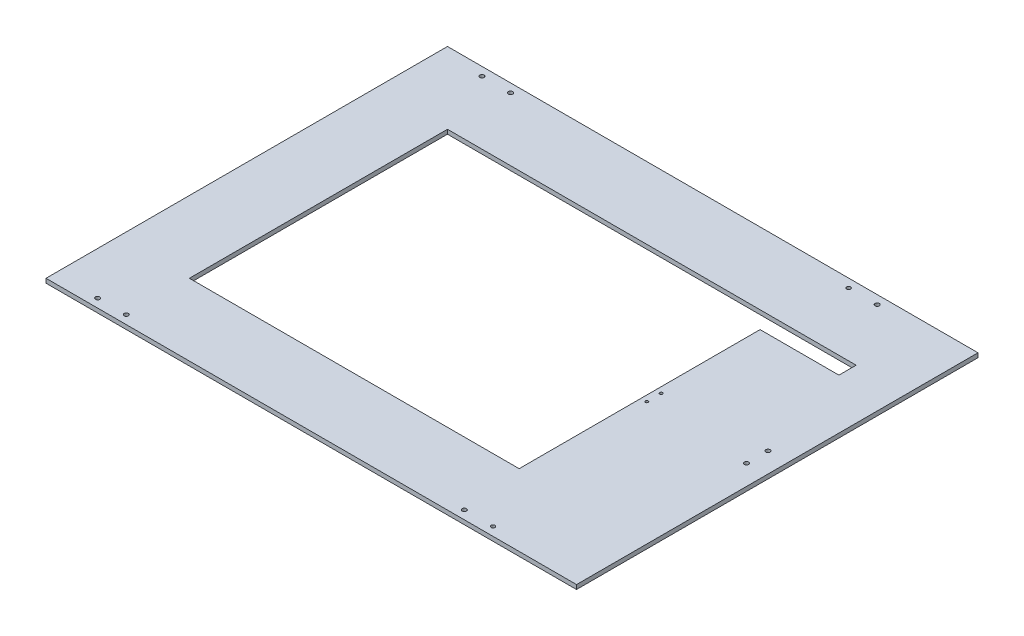
from build123d import *

# Parameters (mm, degrees)
SKETCH1_W           = 370
SKETCH1_H           = 280
SKETCH1_R           = 1.5
SKETCH1_R_2         = 1.569181713
SKETCH1_R_3         = 1.357318829
SKETCH1_R_4         = 1.322467774
SKETCH1_R_5         = 1
SKETCH1_W_2         = 230
SKETCH1_H_2         = 180
BOSS_EXTRUDE1_DEPTH = 3
SKETCH2_W           = 55
SKETCH2_H           = 12
CUT_EXTRUDE1_DEPTH  = 10
SKETCH3_R           = 1.5
CUT_EXTRUDE2_DEPTH  = 10


with BuildPart() as part:
    # Sketch1 → Boss-Extrude1 (new body)
    with BuildSketch(Plane(origin=(0, 0, 0), x_dir=(1, 0, 0), z_dir=(0, 1, 0))):
        with Locations((185, 140)):
            Rectangle(SKETCH1_W, SKETCH1_H)
        with Locations((30, 274)):
            Circle(SKETCH1_R, mode=Mode.SUBTRACT)
        with Locations((50, 274)):
            Circle(SKETCH1_R_2, mode=Mode.SUBTRACT)
        with Locations((30, 6)):
            Circle(SKETCH1_R, mode=Mode.SUBTRACT)
        with Locations((50, 6)):
            Circle(SKETCH1_R, mode=Mode.SUBTRACT)
        with Locations((285.756924446, 273.985388104)):
            Circle(SKETCH1_R_3, mode=Mode.SUBTRACT)
        with Locations((305.756860025, 273.934625414)):
            Circle(SKETCH1_R, mode=Mode.SUBTRACT)
        with Locations((285.756860726, 6.001523901)):
            Circle(SKETCH1_R, mode=Mode.SUBTRACT)
        with Locations((305.756860025, 6.006818111)):
            Circle(SKETCH1_R_4, mode=Mode.SUBTRACT)
        with Locations((284, 145)):
            Circle(SKETCH1_R_5, mode=Mode.SUBTRACT)
        with Locations((284, 135)):
            Circle(SKETCH1_R_5, mode=Mode.SUBTRACT)
        with Locations((165, 140)):
            Rectangle(SKETCH1_W_2, SKETCH1_H_2, mode=Mode.SUBTRACT)
    extrude(amount=BOSS_EXTRUDE1_DEPTH)

    # Sketch2 → Cut-Extrude1 (cut)
    with BuildSketch(Plane(origin=(0, 3, 0), x_dir=(1, 0, 0), z_dir=(0, 1, 0))):
        with Locations((307.5, 224)):
            Rectangle(SKETCH2_W, SKETCH2_H)
    extrude(amount=-CUT_EXTRUDE1_DEPTH, mode=Mode.SUBTRACT)

    # Sketch3 → Cut-Extrude2 (cut)
    with BuildSketch(Plane(origin=(0, 3, 0), x_dir=(1, 0, 0), z_dir=(0, 1, 0))):
        with Locations((356, 147.5)):
            Circle(SKETCH3_R)
        with Locations((356, 132.5)):
            Circle(SKETCH3_R)
    extrude(amount=-CUT_EXTRUDE2_DEPTH, mode=Mode.SUBTRACT)


solid = part.part
